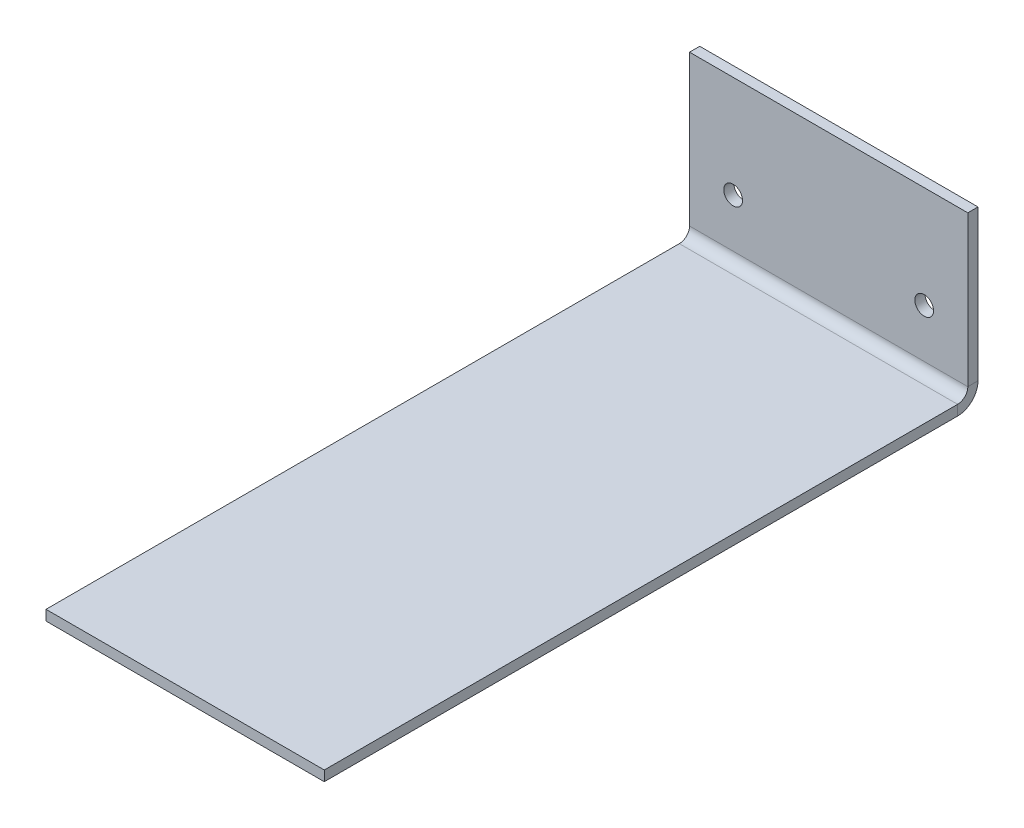
from build123d import *

# Parameters (mm, degrees)
SKETCH1_W              = 43.69375
SKETCH1_H              = 126.6
SKETCH1_R              = 1.4732
BASE_FLANGE1_DEPTH     = 1.6002
SKETCHED_BEND1_DEPTH   = 43.69375
SKETCHED_BEND1_2_DEPTH = 43.69375


# Read off the part's stored shape, not the designer's step: Sketched Bend1
# Sheet-metal steps are written as plain solids
with BuildPart() as part:
    # Sketch1 → Base-Flange1 (new body)
    with BuildSketch(Plane.XY):
        with Locations((21.846875, -63.3)):
            Rectangle(SKETCH1_W, SKETCH1_H)
        with Locations((6.846875, -16.01)):
            Circle(SKETCH1_R, mode=Mode.SUBTRACT)
        with Locations((36.846875, -16.01)):
            Circle(SKETCH1_R, mode=Mode.SUBTRACT)
    extrude(amount=-BASE_FLANGE1_DEPTH)

    # Sketched Bend1 outline → Sketched Bend1 (cut)
    with BuildSketch(Plane.YZ):
        with BuildLine():
            ThreePointArc((-23.640488203, -1.6002), (-25.240688203, -1.171427702), (-26.412115905, 0))
            Line((-26.412115905, 0), (-126.6, 0))
            Line((-126.6, 0), (-126.6, -1.6002))
            Line((-126.6, -1.6002), (-23.640488203, -1.6002))
        make_face()
    extrude(amount=SKETCHED_BEND1_DEPTH, mode=Mode.SUBTRACT)

    # Sketched Bend1 2 outline → Sketched Bend1 2 (add)
    with BuildSketch(Plane.YZ):
        with BuildLine():
            ThreePointArc((-23.640488203, 0), (-24.772000474, 0.468687729), (-25.240688203, 1.6002))
            Line((-25.240688203, 1.6002), (-25.240688203, 101.040688203))
            Line((-25.240688203, 101.040688203), (-26.840888203, 101.040688203))
            Line((-26.840888203, 101.040688203), (-26.840888203, 1.6002))
            ThreePointArc((-26.840888203, 1.6002), (-26.731837217, 0.771875528), (-26.412115905, 0))
            Line((-26.412115905, 0), (-23.640488203, 0))
        make_face()
    extrude(amount=SKETCHED_BEND1_2_DEPTH)


solid = part.part
